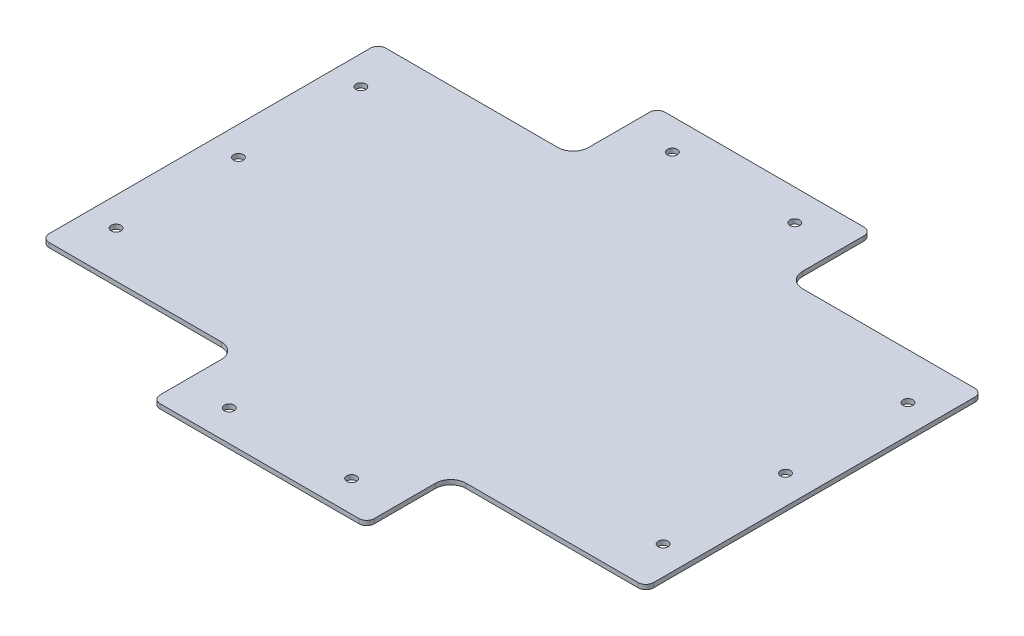
from build123d import *

# Parameters (mm, degrees)
SKETCH_1_R      = 3.2
EXTRUDE_1_DEPTH = 3


with BuildPart() as part:
    # Эскиз1 → Бобышка-Вытянуть1 (new body)
    with BuildSketch(Plane(origin=(0, 0, 0), x_dir=(1, 0, 0), z_dir=(0, 1, 0))):
        with BuildLine():
            ThreePointArc((-70, -160), (-68.535533906, -163.535533906), (-65, -165))
            Line((-65, -165), (65, -165))
            ThreePointArc((65, -165), (68.535533906, -163.535533906), (70, -160))
            Line((70, -160), (70, -120))
            ThreePointArc((70, -120), (72.928932188, -112.928932188), (80, -110))
            Line((80, -110), (134.901841239, -110))
            Line((134.901841239, -110), (160.901841239, -110))
            Line((160.901841239, -110), (192.5, -110))
            ThreePointArc((192.5, -110), (196.035533906, -108.535533906), (197.5, -105))
            Line((197.5, -105), (197.5, 105))
            ThreePointArc((197.5, 105), (196.035533906, 108.535533906), (192.5, 110))
            Line((192.5, 110), (160.901841239, 110))
            Line((160.901841239, 110), (134.901841239, 110))
            Line((134.901841239, 110), (80, 110))
            ThreePointArc((80, 110), (72.928932188, 112.928932188), (70, 120))
            Line((70, 120), (70, 160))
            ThreePointArc((70, 160), (68.535533906, 163.535533906), (65, 165))
            Line((65, 165), (-65, 165))
            ThreePointArc((-65, 165), (-68.535533906, 163.535533906), (-70, 160))
            Line((-70, 160), (-70, 120))
            ThreePointArc((-70, 120), (-72.928932188, 112.928932188), (-80, 110))
            Line((-80, 110), (-134.901841239, 110))
            Line((-134.901841239, 110), (-160.901841239, 110))
            Line((-160.901841239, 110), (-192.5, 110))
            ThreePointArc((-192.5, 110), (-196.035533906, 108.535533906), (-197.5, 105))
            Line((-197.5, 105), (-197.5, -105))
            ThreePointArc((-197.5, -105), (-196.035533906, -108.535533906), (-192.5, -110))
            Line((-192.5, -110), (-80, -110))
            ThreePointArc((-80, -110), (-72.928932188, -112.928932188), (-70, -120))
            Line((-70, -120), (-70, -160))
        make_face()
        with Locations((-40, -144.805454142)):
            Circle(SKETCH_1_R, mode=Mode.SUBTRACT)
        with Locations((-178.768667216, -80)):
            Circle(SKETCH_1_R, mode=Mode.SUBTRACT)
        with Locations((40, -144.805454142)):
            Circle(SKETCH_1_R, mode=Mode.SUBTRACT)
        with Locations((178.768667216, -80)):
            Circle(SKETCH_1_R, mode=Mode.SUBTRACT)
        with Locations((-178.768667216, 0)):
            Circle(SKETCH_1_R, mode=Mode.SUBTRACT)
        with Locations((-178.768667216, 80)):
            Circle(SKETCH_1_R, mode=Mode.SUBTRACT)
        with Locations((-40, 144.805454142)):
            Circle(SKETCH_1_R, mode=Mode.SUBTRACT)
        with Locations((178.768667216, 0)):
            Circle(SKETCH_1_R, mode=Mode.SUBTRACT)
        with Locations((178.768667216, 80)):
            Circle(SKETCH_1_R, mode=Mode.SUBTRACT)
        with Locations((40, 144.805454142)):
            Circle(SKETCH_1_R, mode=Mode.SUBTRACT)
    extrude(amount=EXTRUDE_1_DEPTH)


solid = part.part
